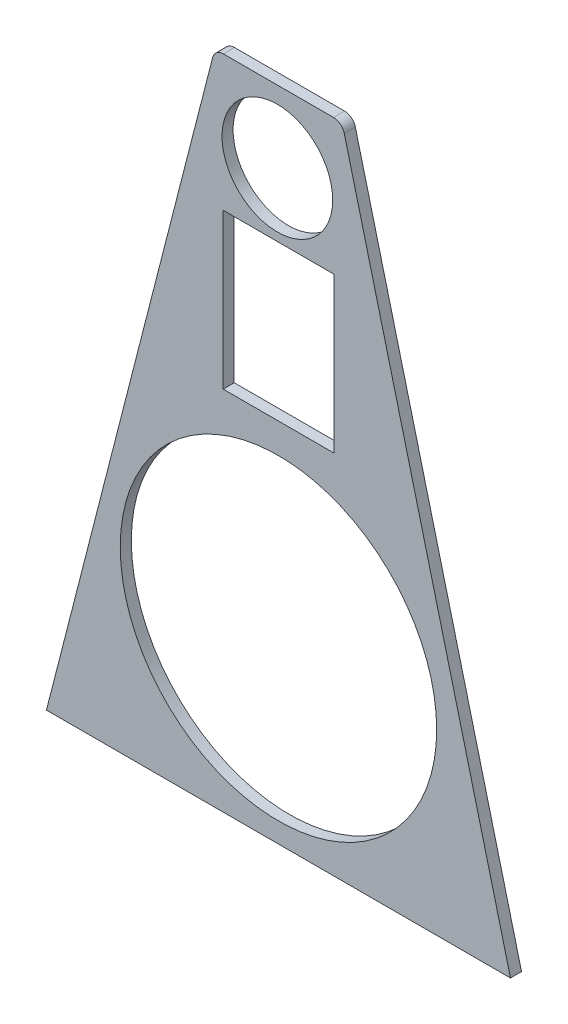
from build123d import *

# Parameters (mm, degrees)
SKETCH3_R           = 715
SKETCH3_R_2         = 250
SKETCH3_W           = 500
SKETCH3_H           = 700
BOSS_EXTRUDE1_DEPTH = 50


with BuildPart() as part:
    # Sketch3 → Boss-Extrude1 (new body)
    with BuildSketch(Plane.XY):
        with BuildLine():
            Line((-983.081569538, -1694.270819985), (1113.71266689, -1694.270819985))
            Line((1113.71266689, -1694.270819985), (362.516639902, 1235.936167947))
            ThreePointArc((362.516639902, 1235.936167947), (344.735540122, 1263.021649549), (314.082893486, 1273.519557779))
            Line((314.082893486, 1273.519557779), (-183.451796134, 1273.519557779))
            ThreePointArc((-183.451796134, 1273.519557779), (-214.10444277, 1263.021649549), (-231.885542551, 1235.936167947))
            Line((-231.885542551, 1235.936167947), (-983.081569538, -1694.270819985))
        make_face()
        with Locations((65.315548676, -888.891859179)):
            Circle(SKETCH3_R, mode=Mode.SUBTRACT)
        with Locations((60.29466546, 948.352728731)):
            Circle(SKETCH3_R_2, mode=Mode.SUBTRACT)
        with Locations((65.315548676, 311.108140821)):
            Rectangle(SKETCH3_W, SKETCH3_H, mode=Mode.SUBTRACT)
    extrude(amount=BOSS_EXTRUDE1_DEPTH)


solid = part.part
